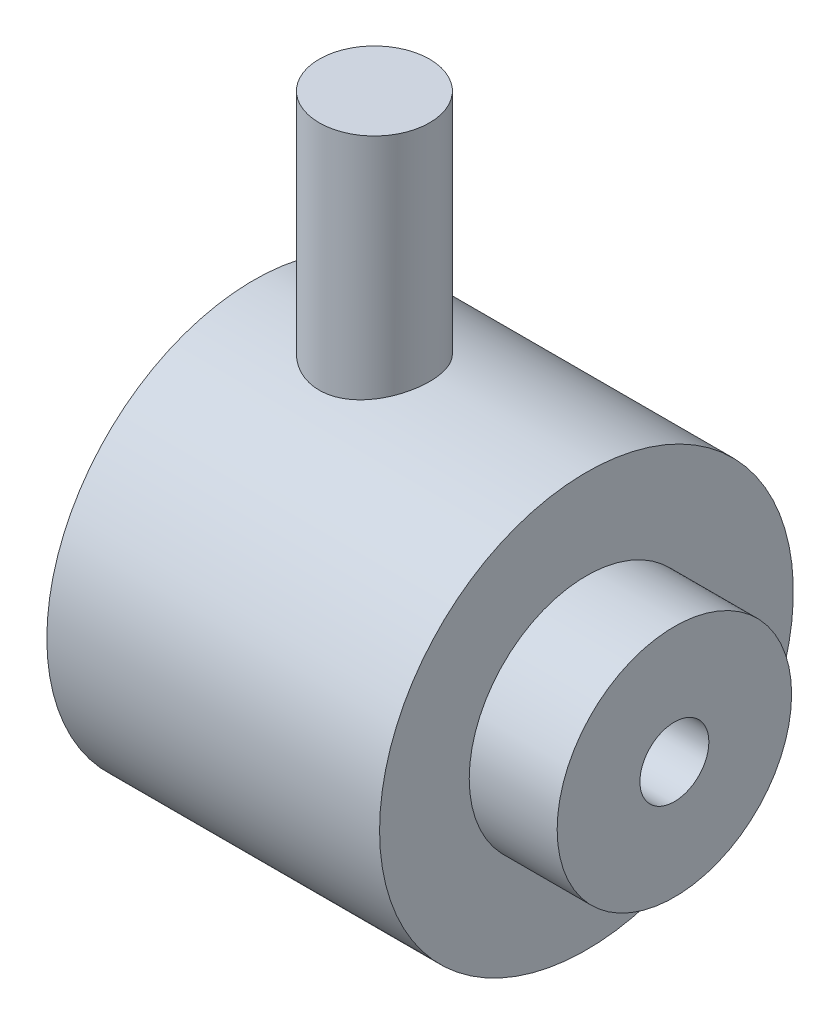
from build123d import *

# Parameters (mm, degrees)
ESQUISSE2_R             = 3.2
BOSS_EXTRU_1_DEPTH      = 25
ESQUISSE3_R             = 2
ENL_V_MAT_EXTRU_1_DEPTH = 14


with BuildPart() as part:
    # Esquisse1 → Révolution2 (revolve)
    with BuildSketch(Plane.XY):
        Polygon((0, 0), (24.4, 0), (24.4, 6.8), (19.3, 6.8), (19.3, 12), (0, 12), align=None)
    revolve(axis=Axis((0, 0, 0), (1, 0, 0)))

    # Esquisse2 → Boss.-Extru.1 (add)
    with BuildSketch(Plane(origin=(0, 0, 0), x_dir=(1, 0, 0), z_dir=(0, 1, 0))):
        with Locations((7, 0)):
            Circle(ESQUISSE2_R)
    extrude(amount=BOSS_EXTRU_1_DEPTH)

    # Esquisse3 → Enlèv. mat.-Extru.1 (cut)
    with BuildSketch(Plane(origin=(24.4, 0, 0), x_dir=(0, 0, -1), z_dir=(1, 0, 0))):
        Circle(ESQUISSE3_R)
    extrude(amount=-ENL_V_MAT_EXTRU_1_DEPTH, mode=Mode.SUBTRACT)


solid = part.part
